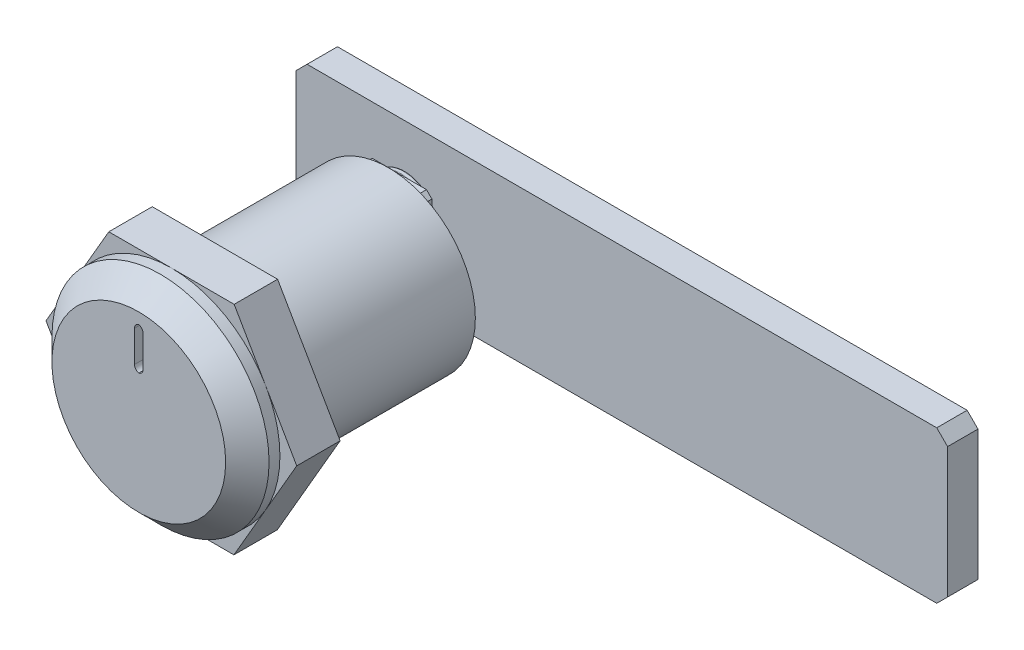
from build123d import *

# Parameters (mm, degrees)
BOSS_EXTRUDE1_DEPTH     = 4
SKETCH2_R               = 8
BOSS_EXTRUDE2_DEPTH     = 16
CUT_EXTRUDE1_DEPTH      = 16
SKETCH5_R               = 10
BOSS_EXTRUDE4_DEPTH     = 3
CHAMFER2_SIZE           = 2
SKETCH6_W               = 0.795923982
SKETCH6_H               = 3.882038779
CUT_EXTRUDE2_DEPTH      = 3
FILLET2_R               = 0.5
SKETCH9_W               = 6
SKETCH9_H               = 6
SKETCH9_R               = 2
BOSS_EXTRUDE6_DEPTH     = 1
CHAMFER3_SIZE           = 0.5
SKETCH10_R              = 3
SKETCH10_R_2            = 2
BOSS_EXTRUDE7_DEPTH     = 0.5
FILLET3_R               = 0.1
BOSS_EXTRUDE8_OUTLINE_W = 60
BOSS_EXTRUDE8_OUTLINE_H = 14
BOSS_EXTRUDE8_OUTLINE_R = 2.9
BOSS_EXTRUDE8_DEPTH     = 2.8
CHAMFER4_SIZE           = 1


# Read off the part's stored shape, not the designer's step: Boss-Extrude8
with BuildPart() as part:
    # Sketch1 → Boss-Extrude1 (new body)
    with BuildSketch(Plane.XY):
        Polygon((5.785468513, 9.993081978), (-5.761528598, 10.006903694), (-11.546997112, 0.013821717), (-5.785468513, -9.993081978), (5.761528598, -10.006903694), (11.546997112, -0.013821717), align=None)
    extrude(amount=-BOSS_EXTRUDE1_DEPTH)

    # Sketch2 → Boss-Extrude2 (add)
    with BuildSketch(Plane(origin=(0, 0, -4), x_dir=(-1, 0, 0), z_dir=(0, 0, -1))):
        with Locations(Location((0, 0, 0), (0, 0, 180))):
            Circle(SKETCH2_R)
    extrude(amount=BOSS_EXTRUDE2_DEPTH)

    # Sketch3 → Cut-Extrude1 (cut)
    with BuildSketch(Plane(origin=(0, 0, -20), x_dir=(-1, 0, 0), z_dir=(0, 0, -1))):
        with BuildLine():
            Line((-1, 1.171572875), (-1, -6.92820323))
            ThreePointArc((-1, -6.92820323), (-7, 0), (-1, 6.92820323))
            Line((-1, 6.92820323), (-1, 6.828427125))
            ThreePointArc((-1, 6.828427125), (-3, 4), (-1, 1.171572875))
        make_face()
        with BuildLine():
            Line((1, 1.171572875), (1, -6.92820323))
            ThreePointArc((1, -6.92820323), (7, 0), (1, 6.92820323))
            Line((1, 6.92820323), (1, 6.828427125))
            ThreePointArc((1, 6.828427125), (3, 4), (1, 1.171572875))
        make_face()
    extrude(amount=-CUT_EXTRUDE1_DEPTH, mode=Mode.SUBTRACT)

    # Sketch5 → Boss-Extrude4 (add)
    with BuildSketch(Plane.XY):
        with Locations(Location((0, 0, 0), (0, 0, 209.931417178))):
            Circle(SKETCH5_R)
    extrude(amount=BOSS_EXTRUDE4_DEPTH)

    # Chamfer2
    chamfer2_edges = [part.edges().sort_by_distance(p)[0] for p in [
        (8.666232812, 4.989630131, 3),
    ]]
    chamfer(chamfer2_edges, length=CHAMFER2_SIZE)

    # Sketch6 → Cut-Extrude2 (cut)
    with BuildSketch(Plane.XY.offset(3)):
        with Locations((0, 5.044443369)):
            Rectangle(SKETCH6_W, SKETCH6_H)
    extrude(amount=-CUT_EXTRUDE2_DEPTH, mode=Mode.SUBTRACT)

    # Fillet2
    # the kernel refuses this fillet: 0.5 mm, written as the material it adds along each edge
    with BuildSketch(Plane(origin=(0.397961991, 3.103423979, 3), x_dir=(-1, 0, 0), z_dir=(0, 0, -1)), Plane(origin=(0.397961991, 6.985462758, 3), x_dir=(0, -1, 0), z_dir=(0, 0, -1)), Plane(origin=(-0.397961991, 6.985462758, 3), x_dir=(1, 0, 0), z_dir=(0, 0, -1))) as fillet2_piece_1:
        with BuildLine():
            CenterArc((FILLET2_R, FILLET2_R), FILLET2_R, 180, 90)
            Line((0, FILLET2_R), (0, 0))
            Line((0, 0), (FILLET2_R, 0))
        make_face()
    extrude(amount=4.25)
    with BuildSketch(Plane(origin=(-0.397961991, 3.103423979, 3), x_dir=(1, 0, 0), z_dir=(0, 0, -1))) as fillet2_piece_2:
        with BuildLine():
            CenterArc((FILLET2_R, -FILLET2_R), FILLET2_R, 90, 90)
            Line((0, -FILLET2_R), (0, 0))
            Line((0, 0), (FILLET2_R, 0))
        make_face()
    extrude(amount=4.25)

    # Sketch9 → Boss-Extrude6 (add)
    with BuildSketch(Plane(origin=(0, 0, -20), x_dir=(-1, 0, 0), z_dir=(0, 0, -1))):
        with Locations((0, 4)):
            Rectangle(SKETCH9_W, SKETCH9_H)
        with Locations((0, 4)):
            Circle(SKETCH9_R, mode=Mode.SUBTRACT)
    extrude(amount=BOSS_EXTRUDE6_DEPTH)

    # Chamfer3
    chamfer3_edges = [part.edges().sort_by_distance(p)[0] for p in [
        (-3, 1, -20.5),
        (-3, 7, -20.5),
        (3, 7, -20.5),
        (3, 1, -20.5),
    ]]
    chamfer(chamfer3_edges, length=CHAMFER3_SIZE)


with BuildPart() as body_2:
    # Sketch10 → Boss-Extrude7 (new body)
    with BuildSketch(Plane(origin=(0, 0, -21), x_dir=(-1, 0, 0), z_dir=(0, 0, -1))):
        with Locations((0, 4)):
            Circle(SKETCH10_R)
        with Locations((0, 4)):
            Circle(SKETCH10_R_2, mode=Mode.SUBTRACT)
    extrude(amount=BOSS_EXTRUDE7_DEPTH)

    # Fillet3
    fillet3_edges = [body_2.edges().sort_by_distance(p)[0] for p in [
        (3, 4, -21),
        (3, 4, -21.5),
    ]]
    fillet(fillet3_edges, radius=FILLET3_R)


with BuildPart() as body_3:
    # Boss-Extrude8 outline → Boss-Extrude8 (new body)
    with BuildSketch(Plane(origin=(0, 0, -21.5), x_dir=(-1, 0, 0), z_dir=(0, 0, -1))):
        with Locations((-20, 4)):
            Rectangle(BOSS_EXTRUDE8_OUTLINE_W, BOSS_EXTRUDE8_OUTLINE_H)
        with Locations((0, 4)):
            Circle(BOSS_EXTRUDE8_OUTLINE_R, mode=Mode.SUBTRACT)
    extrude(amount=BOSS_EXTRUDE8_DEPTH)

    # Chamfer4
    chamfer4_edges = [body_3.edges().sort_by_distance(p)[0] for p in [
        (-10, -3, -22.9),
        (50, -3, -22.9),
        (50, 11, -22.9),
        (-10, 11, -22.9),
    ]]
    chamfer(chamfer4_edges, length=CHAMFER4_SIZE)


solid = Compound([part.part, body_2.part, body_3.part])
